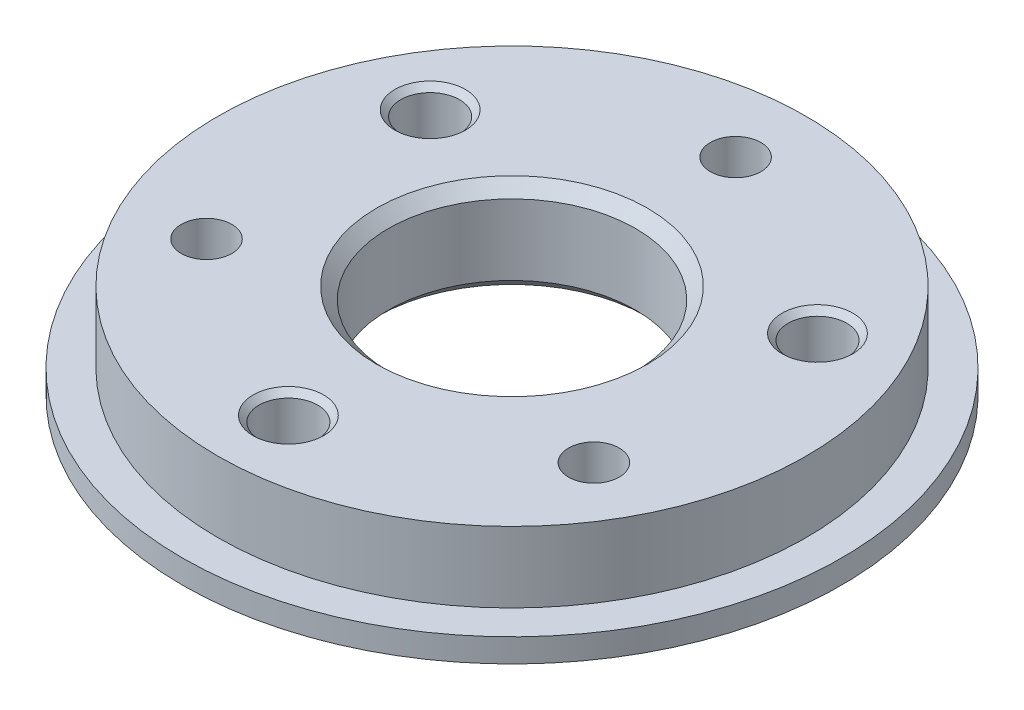
from build123d import *

# Parameters (mm, degrees)
SKETCH1_R                          = 25
SKETCH1_R_2                        = 10.5
BOSS_EXTRUDE1_DEPTH                = 6
SKETCH2_R                          = 2.15
THREADED_TAPPED_HOLE_CUTOUTS_DEPTH = 36.860842154
SKETCH3_R                          = 2.5
PIN_INSERTS_CUTOUT_DEPTH           = 5
BOSS_EXTRUDE2_START                = 2
SKETCH4_R                          = 28
SKETCH4_R_2                        = 10.5
BOSS_EXTRUDE2_DEPTH                = 2
CHAMFER1_SIZE                      = 1
SKETCH5_R                          = 1.25
CUT_EXTRUDE3_DEPTH                 = 5
CHAMFER2_SIZE                      = 0.5
M5X0_8_TAPPED_HOLE1_D              = 4.2
M5X0_8_TAPPED_HOLE1_DEPTH          = 6
M5X0_8_TAPPED_HOLE1_TIP            = 1.2618073
M3X0_5_TAPPED_HOLE2_D              = 2.5
M3X0_5_TAPPED_HOLE2_DEPTH          = 6
M3X0_5_TAPPED_HOLE2_TIP            = 0.751075774


with BuildPart() as part:
    # Sketch1 → Boss-Extrude1 (new body)
    with BuildSketch(Plane(origin=(0, 0, 0), x_dir=(1, 0, 0), z_dir=(0, 1, 0))):
        Circle(SKETCH1_R)
        Circle(SKETCH1_R_2, mode=Mode.SUBTRACT)
    extrude(amount=BOSS_EXTRUDE1_DEPTH)

    # Sketch2 → Threaded Tapped Hole Cutouts (cut, through all)
    with BuildSketch(Plane(origin=(0, 6, 0), x_dir=(1, 0, 0), z_dir=(0, 1, 0))):
        with Locations((0, 19)):
            Circle(SKETCH2_R)
        with Locations((16.454482672, -9.5)):
            Circle(SKETCH2_R)
        with Locations((-16.454482672, -9.5)):
            Circle(SKETCH2_R)
    extrude(amount=-THREADED_TAPPED_HOLE_CUTOUTS_DEPTH, mode=Mode.SUBTRACT)

    # Sketch3 → Pin Inserts Cutout (cut)
    with BuildSketch(Plane(origin=(0, 6, 0), x_dir=(1, 0, 0), z_dir=(0, 1, 0))):
        with Locations((0, -19)):
            Circle(SKETCH3_R)
        with Locations((-16.454482672, 9.5)):
            Circle(SKETCH3_R)
        with Locations((16.454482672, 9.5)):
            Circle(SKETCH3_R)
    extrude(amount=-PIN_INSERTS_CUTOUT_DEPTH, mode=Mode.SUBTRACT)

    # Sketch4 → Boss-Extrude2 (add)
    with BuildSketch(Plane.XZ.offset(BOSS_EXTRUDE2_START)):
        Circle(SKETCH4_R)
        Circle(SKETCH4_R_2, mode=Mode.SUBTRACT)
    extrude(amount=-BOSS_EXTRUDE2_DEPTH)

    # Chamfer1
    chamfer1_edges = [part.edges().sort_by_distance(p)[0] for p in [
        (-10.5, -2, 0),
        (-10.5, 6, 0),
    ]]
    chamfer(chamfer1_edges, length=CHAMFER1_SIZE)

    # Sketch5 → Cut-Extrude3 (cut)
    with BuildSketch(Plane.XZ.offset(2)):
        with Locations((-20, 0)):
            Circle(SKETCH5_R)
        with Locations((-9.9995, 17.321374101)):
            Circle(SKETCH5_R)
        with Locations((10.0015, 17.321374101)):
            Circle(SKETCH5_R)
        with Locations((20.002, 0)):
            Circle(SKETCH5_R)
        with Locations((10.0015, -17.321374101)):
            Circle(SKETCH5_R)
        with Locations((-9.9995, -17.321374101)):
            Circle(SKETCH5_R)
    extrude(amount=-CUT_EXTRUDE3_DEPTH, mode=Mode.SUBTRACT)

    # Chamfer2
    chamfer2_edges = [part.edges().sort_by_distance(p)[0] for p in [
        (13.954482672, 6, -9.5),
        (-18.954482672, 6, -9.5),
        (-2.5, 6, 19),
    ]]
    chamfer(chamfer2_edges, length=CHAMFER2_SIZE)

    # M5x0.8 Tapped Hole1
    with Locations(Plane(origin=(0, 6, 0), x_dir=(1, 0, 0), z_dir=(0, 1, 0))):
        with Locations((-16.454482672, -9.5), (0, 19), (16.454482672, -9.5)):
            Hole(M5X0_8_TAPPED_HOLE1_D / 2, depth=M5X0_8_TAPPED_HOLE1_DEPTH)
            with Locations((0, 0, -(M5X0_8_TAPPED_HOLE1_DEPTH + M5X0_8_TAPPED_HOLE1_TIP / 2))):  # 118° drill point
                Cone(0, M5X0_8_TAPPED_HOLE1_D / 2, M5X0_8_TAPPED_HOLE1_TIP, mode=Mode.SUBTRACT)

    # M3x0.5 Tapped Hole2
    with Locations(Plane(origin=(0, -2, 0), x_dir=(-1, 0, 0), z_dir=(0, -1, 0))):
        with Locations((10, -17.320508076), (-10, -17.320508076), (-20, 0), (-10, 17.320508076), (9.9995, 17.321374101), (20, 0)):
            Hole(M3X0_5_TAPPED_HOLE2_D / 2, depth=M3X0_5_TAPPED_HOLE2_DEPTH)
            with Locations((0, 0, -(M3X0_5_TAPPED_HOLE2_DEPTH + M3X0_5_TAPPED_HOLE2_TIP / 2))):  # 118° drill point
                Cone(0, M3X0_5_TAPPED_HOLE2_D / 2, M3X0_5_TAPPED_HOLE2_TIP, mode=Mode.SUBTRACT)


solid = part.part
